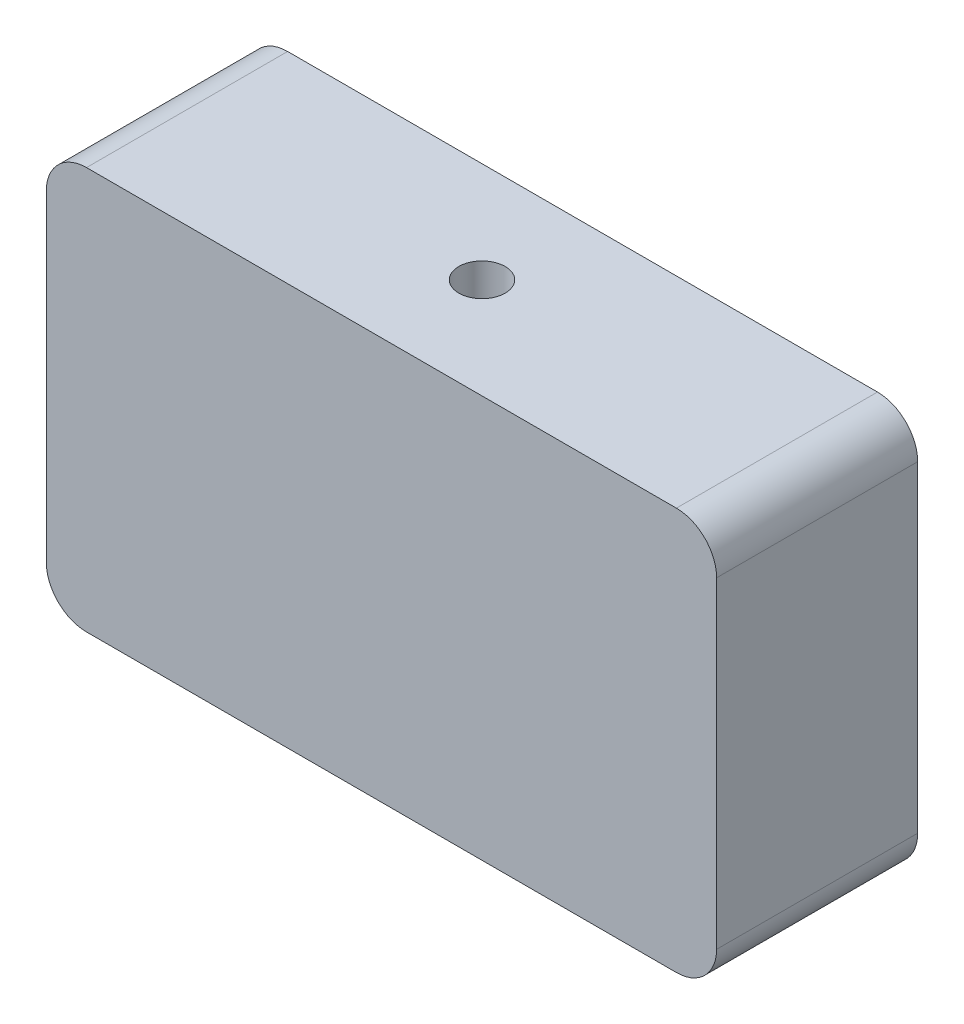
from build123d import *

# Parameters (mm, degrees)
SKETCH2_W                 = 50
SKETCH2_H                 = 30
BOSS_EXTRUDE1_DEPTH       = 15
F_8_32_TAPPED_HOLE1_D     = 3.4544
F_8_32_TAPPED_HOLE1_DEPTH = 5
F_8_32_TAPPED_HOLE1_TIP   = 1.037806461
FILLET1_R                 = 3
FILLET2_R                 = 3
FILLET3_R                 = 3
FILLET4_R                 = 3


with BuildPart() as part:
    # Sketch2 → Boss-Extrude1 (new body)
    with BuildSketch(Plane.XY):
        Rectangle(SKETCH2_W, SKETCH2_H)
    extrude(amount=BOSS_EXTRUDE1_DEPTH)

    # #8-32 Tapped Hole1
    with Locations(Plane(origin=(0, 15, 7.5), x_dir=(0, 0, 1), z_dir=(0, 1, 0))):
        with Locations((0, 0)):
            Hole(F_8_32_TAPPED_HOLE1_D / 2, depth=F_8_32_TAPPED_HOLE1_DEPTH)
            with Locations((0, 0, -(F_8_32_TAPPED_HOLE1_DEPTH + F_8_32_TAPPED_HOLE1_TIP / 2))):  # 118° drill point
                Cone(0, F_8_32_TAPPED_HOLE1_D / 2, F_8_32_TAPPED_HOLE1_TIP, mode=Mode.SUBTRACT)

    # Fillet1
    fillet1_edges = [part.edges().sort_by_distance(p)[0] for p in [
        (25, 15, 7.5),
    ]]
    fillet(fillet1_edges, radius=FILLET1_R)

    # Fillet2
    fillet2_edges = [part.edges().sort_by_distance(p)[0] for p in [
        (-25, 15, 7.5),
    ]]
    fillet(fillet2_edges, radius=FILLET2_R)

    # Fillet3
    fillet3_edges = [part.edges().sort_by_distance(p)[0] for p in [
        (25, -15, 7.5),
    ]]
    fillet(fillet3_edges, radius=FILLET3_R)

    # Fillet4
    fillet4_edges = [part.edges().sort_by_distance(p)[0] for p in [
        (-25, -15, 7.5),
    ]]
    fillet(fillet4_edges, radius=FILLET4_R)


solid = part.part
